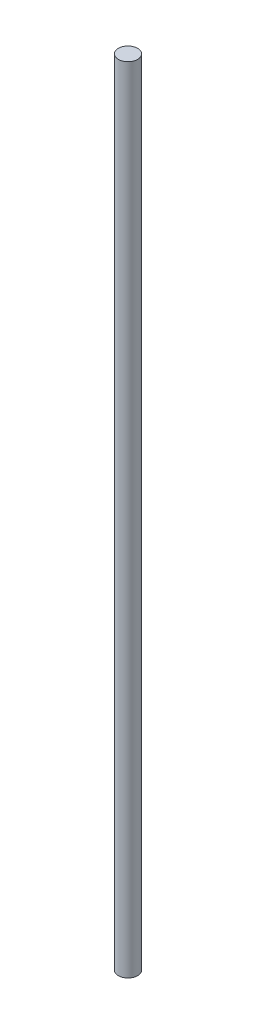
from build123d import *

# Parameters (mm, degrees)
SKETCH1_R           = 4
BOSS_EXTRUDE1_DEPTH = 330
CUT_EXTRUDE1_START  = -3.5
SKETCH2_W           = 3.911370479
SKETCH2_H           = 4.081430066
CUT_EXTRUDE1_DEPTH  = 10


with BuildPart() as part:
    # Sketch1 → Boss-Extrude1 (new body)
    with BuildSketch(Plane(origin=(0, 0, 0), x_dir=(1, 0, 0), z_dir=(0, 1, 0))):
        Circle(SKETCH1_R)
    extrude(amount=BOSS_EXTRUDE1_DEPTH)

    # Sketch2 → Cut-Extrude1 (cut)
    with BuildSketch(Plane.XY.offset(CUT_EXTRUDE1_START)):
        with Locations((-0.357855864, 223.902178758)):
            Rectangle(SKETCH2_W, SKETCH2_H)
        with Locations((-0.357855864, 323.902178758)):
            Rectangle(SKETCH2_W, SKETCH2_H)
        with Locations((-0.357855864, 123.902178758)):
            Rectangle(SKETCH2_W, SKETCH2_H)
        with Locations((-0.357855864, 23.902178758)):
            Rectangle(SKETCH2_W, SKETCH2_H)
    extrude(amount=-CUT_EXTRUDE1_DEPTH, mode=Mode.SUBTRACT)


solid = part.part
